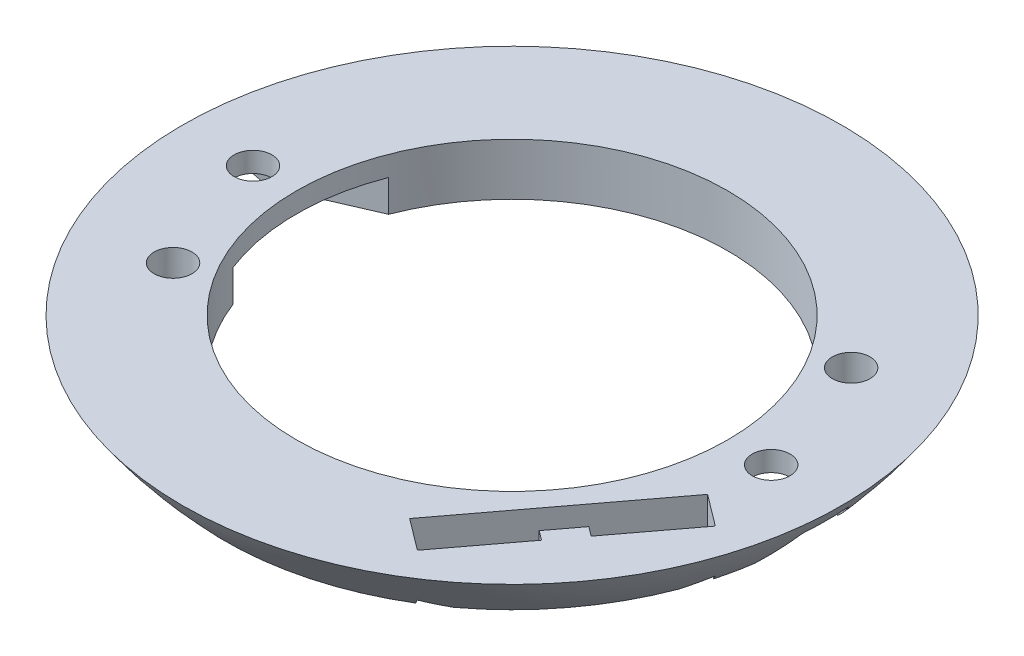
from build123d import *

# Parameters (mm, degrees)
SKETCH2_R                = 33.8
CUT_EXTRUDE1_DEPTH       = 19.1
CUT_EXTRUDE2_START       = -33.8
CUT_EXTRUDE2_DEPTH       = 14.7
BOSS_EXTRUDE2_START      = -1.7
BOSS_EXTRUDE2_DEPTH      = 1.7
CUT_EXTRUDE3_REACH       = 42.172
SKETCH6_R                = 1.6
SKETCH19_R               = 9
CUT_EXTRUDE10_DEPTH      = 1.4
CUT_EXTRUDE11_REACH      = 42.429
CUT_EXTRUDE11_END_RADIUS = 33.8
SKETCH20_R               = 3.5
CUT_EXTRUDE9_REACH       = 44.024
CUT_EXTRUDE9_END_RADIUS  = 33.8
CUT_EXTRUDE7_REACH       = 44.024
CUT_EXTRUDE7_END_RADIUS  = 33.8
SKETCH10_R               = 1.6
CUT_EXTRUDE12_START      = -10.118299
SKETCH21_R               = 27.886018002
CUT_EXTRUDE12_DEPTH      = 10.118299
CUT_EXTRUDE13_REACH      = 41.529


# Read off the part's stored shape, not the designer's step: Revolve2
with BuildPart() as part:
    # Sketch1 → Revolve1 (revolve)
    with BuildSketch(Plane.XY, mode=Mode.PRIVATE) as revolve1_sk:
        with BuildLine():
            Line((0, -33.8), (0, 0))
            Line((0, 0), (33.8, 0))
            ThreePointArc((33.8, 0), (23.900209204, -23.900209204), (0, -33.8))
        make_face()
    revolve(revolve1_sk.sketch.rotate(Axis((0, -33.8, 0), (0, 1, 0)), 180), axis=Axis((0, -33.8, 0), (0, 1, 0)))

    # Sketch2 → Cut-Extrude1 (cut)
    with BuildSketch(Plane(origin=(0, 0, 0), x_dir=(1, 0, 0), z_dir=(0, 1, 0))):
        Circle(SKETCH2_R)
    extrude(amount=-CUT_EXTRUDE1_DEPTH, mode=Mode.SUBTRACT)

    # Sketch5 → Cut-Extrude2 (cut)
    with BuildSketch(Plane(origin=(0, 0, 0), x_dir=(1, 0, 0), z_dir=(0, 1, 0)).offset(CUT_EXTRUDE2_START)):
        with BuildLine():
            Line((-17.025732229, 6.571677263), (-23.544283672, 3.742739979))
            ThreePointArc((-23.544283672, 3.742739979), (-23.775794442, 3.633514413), (-24, 3.509985755))
            Line((-24, 3.509985755), (-24, -3.509985755))
            ThreePointArc((-24, -3.509985755), (-23.775794442, -3.633514413), (-23.544283672, -3.742739979))
            Line((-23.544283672, -3.742739979), (-17.025732229, -6.571677263))
            ThreePointArc((-17.025732229, -6.571677263), (0, -18.25), (17.025732229, -6.571677263))
            Line((17.025732229, -6.571677263), (23.544283672, -3.742739979))
            ThreePointArc((23.544283672, -3.742739979), (23.775794442, -3.633514413), (24, -3.509985755))
            Line((24, -3.509985755), (24, 3.509985755))
            ThreePointArc((24, 3.509985755), (23.775794442, 3.633514413), (23.544283672, 3.742739979))
            Line((23.544283672, 3.742739979), (17.025732229, 6.571677263))
            ThreePointArc((17.025732229, 6.571677263), (0, 18.25), (-17.025732229, 6.571677263))
        make_face()
    extrude(amount=CUT_EXTRUDE2_DEPTH, mode=Mode.SUBTRACT)

    # Sketch16 → Boss-Extrude2 (add)
    with BuildSketch(Plane(origin=(0, -19.1, 0), x_dir=(1, 0, 0), z_dir=(0, 1, 0)).offset(BOSS_EXTRUDE2_START)):
        with BuildLine():
            Line((17.025732229, 6.571677263), (23.544283672, 3.742739979))
            ThreePointArc((23.544283672, 3.742739979), (23.775794442, 3.633514413), (24, 3.509985755))
            Line((24, 3.509985755), (24, -3.509985755))
            ThreePointArc((24, -3.509985755), (23.775794442, -3.633514413), (23.544283672, -3.742739979))
            Line((23.544283672, -3.742739979), (17.025732229, -6.571677263))
            ThreePointArc((17.025732229, -6.571677263), (18.25, 0), (17.025732229, 6.571677263))
        make_face()
        with BuildLine():
            Line((-23.544283672, -3.742739979), (-17.025732229, -6.571677263))
            ThreePointArc((-17.025732229, -6.571677263), (-18.25, 0), (-17.025732229, 6.571677263))
            Line((-17.025732229, 6.571677263), (-23.544283672, 3.742739979))
            ThreePointArc((-23.544283672, 3.742739979), (-23.775794442, 3.633514413), (-24, 3.509985755))
            Line((-24, 3.509985755), (-24, -3.509985755))
            ThreePointArc((-24, -3.509985755), (-23.775794442, -3.633514413), (-23.544283672, -3.742739979))
        make_face()
    extrude(amount=BOSS_EXTRUDE2_DEPTH)

    # Sketch6 → Cut-Extrude3 (cut, up to next)
    with BuildSketch(Plane(origin=(0, -20.8, 0), x_dir=(1, 0, 0), z_dir=(0, 1, 0)), mode=Mode.PRIVATE) as cut_extrude3_sk1:
        with Locations(Location((-21.92, 0, 0), (0, 0, 270))):
            Circle(SKETCH6_R)
    cut_extrude3_tool1 = extrude(cut_extrude3_sk1.sketch, amount=CUT_EXTRUDE3_REACH, mode=Mode.PRIVATE) & part.part
    # Sketch6 → Cut-Extrude3 (cut, up to next)
    with BuildSketch(Plane(origin=(0, -20.8, 0), x_dir=(1, 0, 0), z_dir=(0, 1, 0)), mode=Mode.PRIVATE) as cut_extrude3_sk2:
        with Locations(Location((21.92, 0, 0), (0, 0, 270))):
            Circle(SKETCH6_R)
    cut_extrude3_tool2 = extrude(cut_extrude3_sk2.sketch, amount=CUT_EXTRUDE3_REACH, mode=Mode.PRIVATE) & part.part
    add(cut_extrude3_tool1.solids().sort_by_distance((-21.92, -20.8, 0))[0], mode=Mode.SUBTRACT)
    add(cut_extrude3_tool2.solids().sort_by_distance((21.92, -20.8, 0))[0], mode=Mode.SUBTRACT)

    # Revolve2 outline → Revolve2 (revolve)
    with BuildSketch(Plane.XY):
        with BuildLine():
            Line((0, -23.5), (0, -33.8))
            ThreePointArc((0, -33.8), (13.168073663, -31.129436808), (24.255308697, -23.53975361))
            Line((24.255308697, -23.53975361), (24.255308697, -23.5))
            Line((24.255308697, -23.5), (0, -23.5))
        make_face()
    revolve(axis=Axis((0, 0, 0), (0, 1, 0)))

    # Sketch19 → Cut-Extrude10 (cut)
    with BuildSketch(Plane(origin=(0, -23.5, 0), x_dir=(1, 0, 0), z_dir=(0, 1, 0))):
        with Locations(Location((0, 0, 0), (0, 0, 180))):
            Circle(SKETCH19_R)
    extrude(amount=-CUT_EXTRUDE10_DEPTH, mode=Mode.SUBTRACT)

    # Cut-Extrude11: up to this sphere (the profile starts inside it)
    cut_extrude11_end = Location((0, 0, 0)) * Sphere(CUT_EXTRUDE11_END_RADIUS, mode=Mode.PRIVATE)
    # Sketch20 → Cut-Extrude11 (cut, up to the surface)
    with BuildSketch(Plane(origin=(0, -24.9, 0), x_dir=(1, 0, 0), z_dir=(0, 1, 0)), mode=Mode.PRIVATE) as cut_extrude11_sk1:
        with Locations(Location((0, 0, 0), (0, 0, 180))):
            Circle(SKETCH20_R)
    cut_extrude11_tool1 = extrude(cut_extrude11_sk1.sketch, amount=-CUT_EXTRUDE11_REACH, mode=Mode.PRIVATE) & cut_extrude11_end
    add(cut_extrude11_tool1.solids().sort_by_distance((0, -24.9, 0))[0], mode=Mode.SUBTRACT)

    # Cut-Extrude9: up to this sphere (the profile starts inside it)
    cut_extrude9_end = Location((0, 0, 0)) * Sphere(CUT_EXTRUDE9_END_RADIUS, mode=Mode.PRIVATE)
    # Sketch13 → Cut-Extrude9 (cut, up to the surface)
    with BuildSketch(Plane(origin=(0, -19.1, 0), x_dir=(1, 0, 0), z_dir=(0, 1, 0)), mode=Mode.PRIVATE) as cut_extrude9_sk1:
        Polygon((10.556374993, -19.224020053), (13.210464636, -21.224020053), (17.724077309, -15.234253728), (16.925441799, -14.632438705), (18.730886869, -12.236532175), (19.529522379, -12.838347198), (24.043135053, -6.848580873), (21.389045409, -4.848580873), align=None)
    cut_extrude9_tool1 = extrude(cut_extrude9_sk1.sketch, amount=-CUT_EXTRUDE9_REACH, mode=Mode.PRIVATE) & cut_extrude9_end
    add(cut_extrude9_tool1.solids().sort_by_distance((17.250772, -19.1, 12.999389))[0], mode=Mode.SUBTRACT)

    # Cut-Extrude7: up to this sphere (the profile starts inside it)
    cut_extrude7_end = Location((0, 0, 0)) * Sphere(CUT_EXTRUDE7_END_RADIUS, mode=Mode.PRIVATE)
    # Sketch10 → Cut-Extrude7 (cut, up to the surface)
    with BuildSketch(Plane(origin=(0, -19.1, 0), x_dir=(1, 0, 0), z_dir=(0, 1, 0)), mode=Mode.PRIVATE) as cut_extrude7_sk1:
        with Locations(Location((-18.186533479, -10.5, 0), (0, 0, 270))):
            Circle(SKETCH10_R)
    cut_extrude7_tool1 = extrude(cut_extrude7_sk1.sketch, amount=-CUT_EXTRUDE7_REACH, mode=Mode.PRIVATE) & cut_extrude7_end
    add(cut_extrude7_tool1.solids().sort_by_distance((-18.186533, -19.1, 10.5))[0], mode=Mode.SUBTRACT)
    # Sketch10 → Cut-Extrude7 (cut, up to the surface)
    with BuildSketch(Plane(origin=(0, -19.1, 0), x_dir=(1, 0, 0), z_dir=(0, 1, 0)), mode=Mode.PRIVATE) as cut_extrude7_sk2:
        with Locations(Location((18.186533479, 10.5, 0), (0, 0, 270))):
            Circle(SKETCH10_R)
    cut_extrude7_tool2 = extrude(cut_extrude7_sk2.sketch, amount=-CUT_EXTRUDE7_REACH, mode=Mode.PRIVATE) & cut_extrude7_end
    add(cut_extrude7_tool2.solids().sort_by_distance((18.186533, -19.1, -10.5))[0], mode=Mode.SUBTRACT)

    # Sketch21 → Cut-Extrude12 (cut)
    with BuildSketch(Plane(origin=(0, -23.5, 0), x_dir=(1, 0, 0), z_dir=(0, 1, 0)).offset(CUT_EXTRUDE12_START)):
        Circle(SKETCH21_R)
    extrude(amount=CUT_EXTRUDE12_DEPTH, mode=Mode.SUBTRACT)

    # Sketch23 → Cut-Extrude13 (cut, up to next)
    with BuildSketch(Plane.XZ.offset(20.8), mode=Mode.PRIVATE) as cut_extrude13_sk1:
        Polygon((24, 3.509985755), (24, -3.509985755), (29.923076923, 0), align=None)
    cut_extrude13_tool1 = extrude(cut_extrude13_sk1.sketch, amount=CUT_EXTRUDE13_REACH, mode=Mode.PRIVATE) & part.part
    # Sketch23 → Cut-Extrude13 (cut, up to next)
    with BuildSketch(Plane.XZ.offset(20.8), mode=Mode.PRIVATE) as cut_extrude13_sk2:
        Polygon((-24, 3.509985755), (-24, -3.509985755), (-29.923076923, 0), align=None)
    cut_extrude13_tool2 = extrude(cut_extrude13_sk2.sketch, amount=CUT_EXTRUDE13_REACH, mode=Mode.PRIVATE) & part.part
    add(cut_extrude13_tool1.solids().sort_by_distance((25.974359, -20.8, 0))[0], mode=Mode.SUBTRACT)
    add(cut_extrude13_tool2.solids().sort_by_distance((-25.974359, -20.8, 0))[0], mode=Mode.SUBTRACT)


solid = part.part
